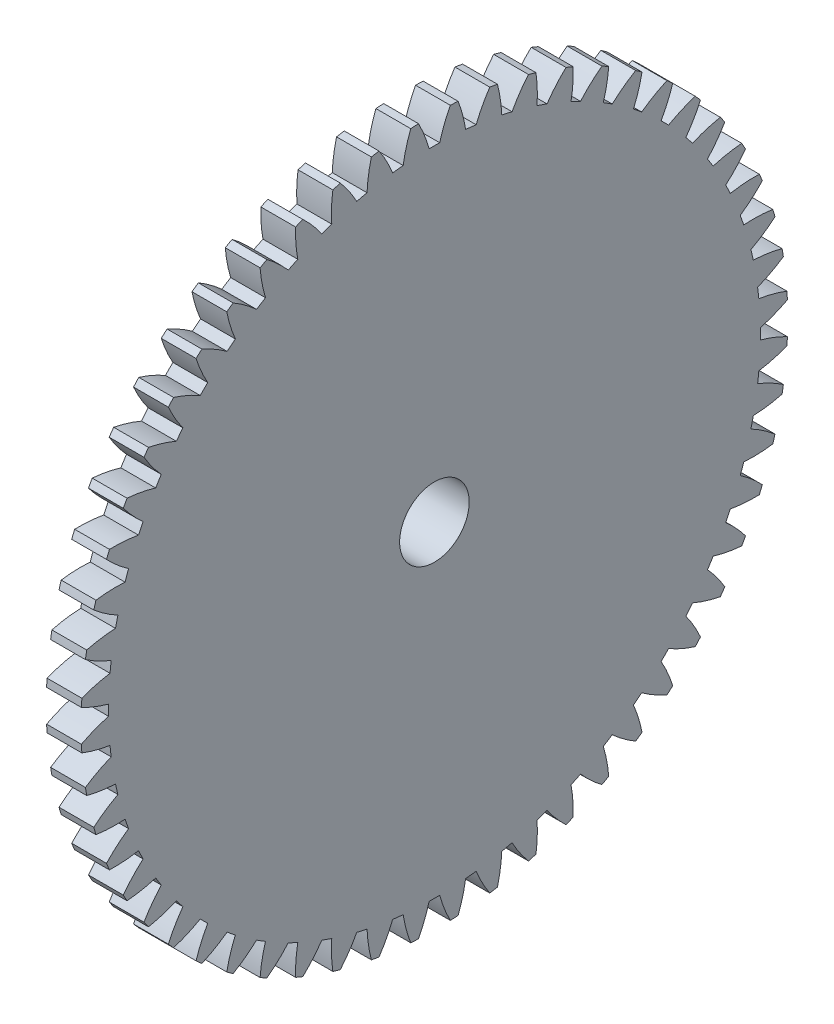
from build123d import *

# Parameters (mm, degrees)
BASPROSKE_W        = 2
BASPROSKE_H        = 20.3
TOOTHCUT_DEPTH     = 29.778116686
TEETHCUTS_COUNT    = 56
TEETHCUTS_ANGLE    = 353.571428571
HUBNEAONESKE_R     = 4.5
HUBNEARONE_DEPTH   = 8.0000508
BORSKE_R           = 2
BORE_DEPTH         = 10.0000508
SKETCH1_2_R        = 1.25
CUT_EXTRUDE1_DEPTH = 5
CUT_SWEEP1_PITCH   = 0.5
SKETCH3_R          = 1.55
CUT_EXTRUDE2_DEPTH = 5
CUT_EXTRUDE2_TAPER = 45


with BuildPart() as part:
    # BasProSke → Base-Revolve (revolve)
    with BuildSketch(Plane(origin=(0, 0, 0), x_dir=(1, 0, 0), z_dir=(0, 1, 0)), mode=Mode.PRIVATE) as base_revolve_sk:
        with Locations((1, 10.15)):
            Rectangle(BASPROSKE_W, BASPROSKE_H)
    revolve(base_revolve_sk.sketch.rotate(Axis((-10, 0, 0), (1, 0, 0)), 180), axis=Axis((-10, 0, 0), (1, 0, 0)))

    # TooCutSke → ToothCut (cut, through all)
    with BuildSketch(Plane(origin=(0, 0, 0), x_dir=(0, 0, -1), z_dir=(1, 0, 0))):
        with BuildLine():
            ThreePointArc((0.303582897, 18.721538757), (0, 18.724), (-0.303582897, 18.721538757))
            ThreePointArc((-0.303582897, 18.721538757), (-0.572582852, 19.529857648), (-0.92769792, 20.304217831))
            ThreePointArc((-0.92769792, 20.304217831), (0, 20.3254), (0.92769792, 20.304217831))
            ThreePointArc((0.92769792, 20.304217831), (0.572582852, 19.529857648), (0.303582897, 18.721538757))
        make_face()
    toothcut = extrude(amount=TOOTHCUT_DEPTH, mode=Mode.SUBTRACT)

    # TeethCuts: ToothCut ×56 about axis
    teethcuts_axis = Axis((-10, 0, 0), (1, 0, 0))
    for i in range(1, TEETHCUTS_COUNT):
        add(toothcut.rotate(teethcuts_axis, i * TEETHCUTS_ANGLE / (TEETHCUTS_COUNT - 1)), mode=Mode.SUBTRACT)

    # HubNeaOneSke → HubNearOne (add)
    with BuildSketch(Plane.ZY):
        with Locations(Location((0, 0, 0), (0, 0, 180))):
            Circle(HUBNEAONESKE_R)
    extrude(amount=HUBNEARONE_DEPTH)

    # BorSke → Bore (cut, symmetric)
    with BuildSketch(Plane(origin=(0, 0, 0), x_dir=(0, 0, -1), z_dir=(1, 0, 0))):
        with Locations(Location((0, 0, 0), (0, 0, 180))):
            Circle(BORSKE_R)
    extrude(amount=BORE_DEPTH, both=True, mode=Mode.SUBTRACT)

    # Sketch1<2> → Cut-Extrude1 (cut)
    with BuildSketch(Plane.XY):
        with Locations((-4, 0)):
            Circle(SKETCH1_2_R)
    extrude(amount=-CUT_EXTRUDE1_DEPTH, mode=Mode.SUBTRACT)

    # Cut-Sweep1: arcs per turn and ends read off the stored shape
    # Cut-Sweep1: the profile of Sketch2 screwed along a right-hand helix through 10 turns, 6 arcs to a turn; built about Z, then put on its axis
    cut_sweep1_z = Axis((0, 0, 0), (0, 0, 1))
    cut_sweep1_corners = [(1.221409363, 0, 0.079867092), (1.221409363, 0, 0.368542226), (1.396409363, 0, 0.267505929), (1.421409363, 0, 0.224204659), (1.396409363, 0, 0.180903389)]
    with BuildLine(mode=Mode.PRIVATE) as cut_sweep1_profile:
        Line(cut_sweep1_corners[0], cut_sweep1_corners[1])
        Line(cut_sweep1_corners[1], cut_sweep1_corners[2])
        Line(cut_sweep1_corners[4], cut_sweep1_corners[0])
        ThreePointArc((1.396409363, 0, 0.267505929), (1.414710634, 0, 0.249204659), (1.421409363, 0, 0.224204659))
        ThreePointArc((1.421409363, 0, 0.224204659), (1.414710634, 0, 0.199204659), (1.396409363, 0, 0.180903389))
    cut_sweep1_cap = Face(cut_sweep1_profile.wire())
    cut_sweep1_arcs = [((1.396409363, 0, 0.267505929), (1.421409363, 0, 0.253072172), (1.421409363, 0, 0.224204659), (1, 0.8660254037844358, 1)), ((1.421409363, 0, 0.224204659), (1.421409363, 0, 0.195337146), (1.396409363, 0, 0.180903389), (1, 0.8660254037844358, 1))]  # start, shoulder, end, weights
    cut_sweep1_turn_angles = [0, 30, 60, 90, 120, 150, 180, 210, 240, 270, 300, 330, 360]
    cut_sweep1_turn_weights = [1, 0.8660254037844387, 1, 0.8660254037844387, 1, 0.8660254037844387, 1, 0.8660254037844387, 1, 0.8660254037844387, 1, 0.8660254037844387, 1]
    cut_sweep1_turn_rails = [Edge.make_bspline([Vector(p[0], p[1], 0).rotate(cut_sweep1_z, cut_sweep1_turn_angles[k]) / cut_sweep1_turn_weights[k] + Vector(0, 0, p[2] + CUT_SWEEP1_PITCH * cut_sweep1_turn_angles[k] / 360) for k in range(13)], [0, 0, 0, 1, 1, 2, 2, 3, 3, 4, 4, 5, 5, 6, 6, 6], 2, cut_sweep1_turn_weights) for p in cut_sweep1_corners]
    cut_sweep1_turn_sides = [*[Face.make_surface_from_curves(cut_sweep1_turn_rails[p[0]], cut_sweep1_turn_rails[p[1]]) for p in [(0, 1), (1, 2), (4, 0)]], *[Face.make_bezier_surface([[Vector(p[j][0], p[j][1], 0).rotate(cut_sweep1_z, cut_sweep1_turn_angles[2 * i + k]) / cut_sweep1_turn_weights[2 * i + k] + Vector(0, 0, p[j][2] + CUT_SWEEP1_PITCH * cut_sweep1_turn_angles[2 * i + k] / 360) for k in range(3)] for j in range(3)], [[p[3][j] * cut_sweep1_turn_weights[2 * i + k] for k in range(3)] for j in range(3)]) for p in cut_sweep1_arcs for i in range(6)]]
    cut_sweep1 = Plane(origin=(-4, 0, 0), x_dir=(-1, 0, 0), z_dir=(0, 0, -1)) * Solid(Shell([*[p.moved(Location((0, 0, CUT_SWEEP1_PITCH * i))) for i in range(10) for p in cut_sweep1_turn_sides], cut_sweep1_cap, cut_sweep1_cap.rotate(cut_sweep1_z, 3600).moved(Location((0, 0, CUT_SWEEP1_PITCH * 3600 / 360)))]))
    add(cut_sweep1, mode=Mode.SUBTRACT)

    # Sketch3 → Cut-Extrude2 (cut)
    with BuildSketch(Plane.XY.offset(-4.5)):
        with Locations((-4, 0)):
            Circle(SKETCH3_R)
    extrude(amount=CUT_EXTRUDE2_DEPTH, taper=CUT_EXTRUDE2_TAPER, mode=Mode.SUBTRACT)


solid = part.part
